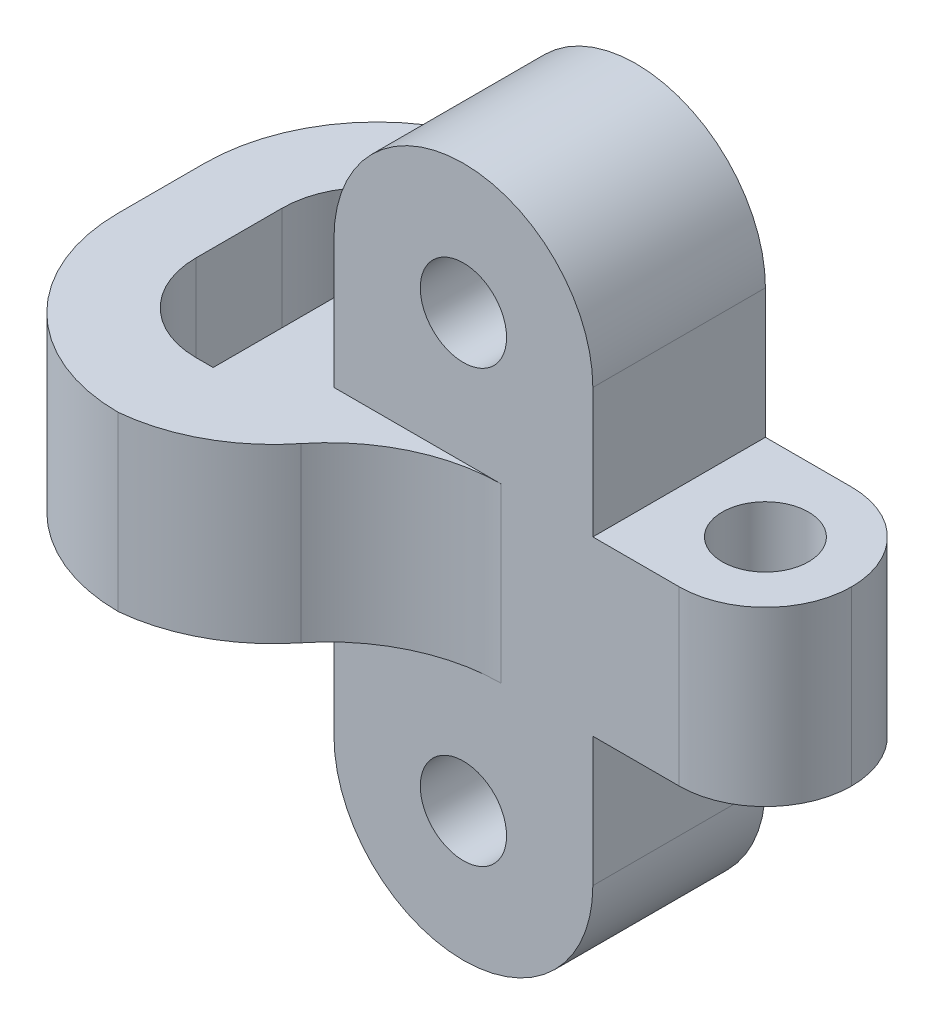
from build123d import *

# Parameters (mm, degrees)
SKETCH1_R           = 2.5
BOSS_EXTRUDE1_DEPTH = 5
SKETCH2_W           = 25
SKETCH2_H           = 10
BOSS_EXTRUDE2_DEPTH = 15
SKETCH3_W           = 6
SKETCH3_H           = 15
CUT_EXTRUDE1_DEPTH  = 15
FILLET1_R           = 10
FILLET2_R           = 10
FILLET3_R           = 5
SKETCH4_W           = 10
SKETCH4_H           = 10
BOSS_EXTRUDE3_DEPTH = 10
FILLET4_R           = 5
SKETCH5_R           = 2.5
CUT_EXTRUDE2_DEPTH  = 10


# Some blends are built 0.0001 mm under size
with BuildPart() as part:
    # Sketch1 → Boss-Extrude1 (new, symmetric)
    with BuildSketch(Plane.XY):
        with BuildLine():
            ThreePointArc((-7.5, 0), (0, -7.5), (7.5, 0))
            Line((7.5, 0), (7.5, 25))
            ThreePointArc((7.5, 25), (0, 32.5), (-7.5, 25))
            Line((-7.5, 25), (-7.5, 0))
        make_face()
        Circle(SKETCH1_R, mode=Mode.SUBTRACT)
        with Locations((0, 25)):
            Circle(SKETCH1_R, mode=Mode.SUBTRACT)
    extrude(amount=BOSS_EXTRUDE1_DEPTH, both=True)

    # Sketch2 → Boss-Extrude2 (add)
    with BuildSketch(Plane.ZY.offset(7.5)):
        with Locations((0, 12.5)):
            Rectangle(SKETCH2_W, SKETCH2_H)
    extrude(amount=BOSS_EXTRUDE2_DEPTH)

    # Sketch3 → Cut-Extrude1 (cut)
    with BuildSketch(Plane(origin=(0, 17.5, 0), x_dir=(1, 0, 0), z_dir=(0, 1, 0))):
        with Locations((-15, 0)):
            Rectangle(SKETCH3_W, SKETCH3_H)
    extrude(amount=-CUT_EXTRUDE1_DEPTH, mode=Mode.SUBTRACT)

    # Fillet1
    # the kernel refuses this fillet: 10 mm, written as the material it adds along each edge
    with BuildSketch(Plane(origin=(-7.5, 17.5, -5), x_dir=(1, 0, 0), z_dir=(0, -1, 0))) as fillet1_piece_1:
        with BuildLine():
            CenterArc((9.682458366, -10), FILLET1_R, 90, 75.522487814)
            Line((0, -7.5), (0, 0))
            Line((0, 0), (9.682458366, 0))
        make_face()
    extrude(amount=10)
    with BuildSketch(Plane(origin=(-7.5, 17.5, 5), x_dir=(1, 0, 0), z_dir=(0, -1, 0))) as fillet1_piece_2:
        with BuildLine():
            CenterArc((9.682458366, 10), FILLET1_R, 194.477512186, 75.522487814)
            Line((0, 7.5), (0, 0))
            Line((0, 0), (9.682458366, 0))
        make_face()
    extrude(amount=10)
    # the kernel refuses this fillet: 10 mm, written as the material it takes off along each edge
    with BuildSketch(Plane(origin=(-22.5, -17.5, 12.5), x_dir=(1, 0, 0), z_dir=(0, 1, 0)), Plane(origin=(-22.5, 42.5, -12.5), x_dir=(1, 0, 0), z_dir=(0, -1, 0))) as fillet1_2_piece_1:
        with BuildLine():
            CenterArc((FILLET1_R, FILLET1_R), FILLET1_R, 180, 90)
            Line((0, FILLET1_R), (0, 0))
            Line((0, 0), (FILLET1_R, 0))
        make_face()
    extrude(amount=60, mode=Mode.SUBTRACT)

    # Fillet2
    # the kernel refuses this fillet: 10 mm, written as the material it takes off along each edge
    with BuildSketch(Plane(origin=(-7.5, 30, -12.5), x_dir=(-1.0, 0, 1.525535253676709e-12), z_dir=(0, -1, 0))) as fillet2_piece_1:
        with BuildLine():
            CenterArc((5.967480043, -9.953089087), FILLET2_R, 95.55193659, 45.937826444)
            Line((-1.857489161, -3.726544543), (-2.013988545, -3.602013652))
            ThreePointArc((-2.013988545, -3.602013652), (-0.911634188, -1.871800915), (-0.193649167, 0.05))
            Line((-0.193649167, 0.05), (0, 0.2))
            ThreePointArc((0, 0.2), (2.5, 0.2), (4.980650399, 0.199061782))
            Line((4.980650399, 0.199061782), (5, 0))
        make_face()
    extrude(amount=35, mode=Mode.SUBTRACT)
    with BuildSketch(Plane(origin=(-7.5, -5, 12.5), x_dir=(0.4461021341851978, 0, -0.8949820589684531), z_dir=(0, 1, 0))) as fillet2_piece_2:
        with BuildLine():
            CenterArc((6.245730581, 9.780881859), FILLET2_R, 212.045811166, 45.937826444)
            Line((-2.230510671, 4.474910295), (-2.400035496, 4.368790864))
            ThreePointArc((-2.400035496, 4.368790864), (-1.294251747, 2.148234721), (-0.178996412, -0.089220427))
            Line((-0.178996412, -0.089220427), (0.041638204, -0.195617637))
            ThreePointArc((0.041638204, -0.195617637), (2.081910194, 0.019118141), (4.122182183, -0.195617637))
            Line((4.122182183, -0.195617637), (4.163820387, 0))
        make_face()
    extrude(amount=35, mode=Mode.SUBTRACT)

    # Fillet3
    fillet3_edges = [part.edges().sort_by_distance(p)[0] for p in [
        (-18, 12.5, 7.5),
        (-18, 12.5, -7.5),
    ]]
    fillet(fillet3_edges, radius=FILLET3_R)

    # Sketch4 → Boss-Extrude3 (add)
    with BuildSketch(Plane(origin=(7.5, 0, 0), x_dir=(0, 0, -1), z_dir=(1, 0, 0))):
        with Locations((0, 12.5)):
            Rectangle(SKETCH4_W, SKETCH4_H)
    extrude(amount=BOSS_EXTRUDE3_DEPTH)

    # Fillet4
    fillet4_edges = [part.edges().sort_by_distance(p)[0] for p in [
        (17.5, 12.5, -5),
        (17.5, 12.5, 5),
    ]]
    fillet(fillet4_edges, radius=FILLET4_R - 0.0001)  # a hair under: the kernel refuses the full size

    # Sketch5 → Cut-Extrude2 (cut)
    with BuildSketch(Plane(origin=(0, 17.5, 0), x_dir=(1, 0, 0), z_dir=(0, 1, 0))):
        with Locations(Location((12.5, 0, 0), (0, 0, 270))):
            Circle(SKETCH5_R)
    extrude(amount=-CUT_EXTRUDE2_DEPTH, mode=Mode.SUBTRACT)


solid = part.part
